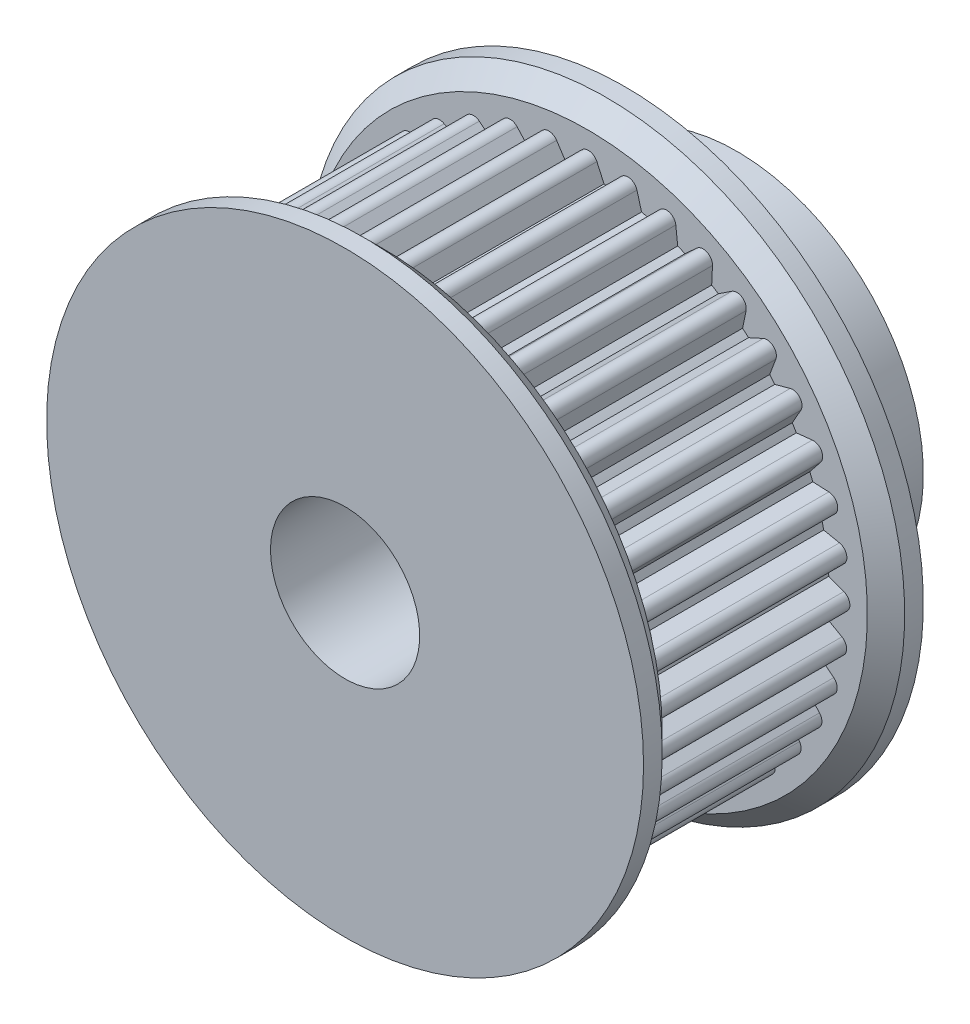
from build123d import *

# Parameters (mm, degrees)
EXTRUDE_3_DEPTH           = 11
FILLET_3_R                = 0.5
SKETCH_3_R                = 16
EXTRUDE_4_DEPTH           = 2
EXTRUDE_START             = 2
SKETCH_4_R                = 16
EXTRUDE_5_DEPTH           = 2
CHAMFER_1_SIZE            = 1
CHAMFER_2_SIZE            = 1
SKETCH_5_R                = 10
EXTRUDE_6_DEPTH           = 6
SKETCH_6_R                = 4
CUT_EXTRUDE_1_DEPTH       = 31.870698081
HOLE_WIZARD_5_44_1_REACH  = 37.428
HOLE_WIZARD_5_44_1_BORE_R = 1.3208
HOLE_WIZARD_5_44_2_D      = 2.6416
HOLE_WIZARD_5_44_2_DEPTH  = 10


with BuildPart() as part:
    # 草图1 → 凸台-拉伸3 (new body)
    with BuildSketch(Plane.XY):
        with BuildLine():
            Line((0.88236931, 12.919904195), (0, 14.865750082))
            Line((0, 14.865750082), (-0.728069899, 12.929517169))
            ThreePointArc((-0.728069899, 12.929517169), (-0.938966192, 12.915914311), (-1.149612422, 12.898871706))
            Line((-1.149612422, 12.898871706), (-2.325515662, 14.68272803))
            Line((-2.325515662, 14.68272803), (-2.741728252, 12.656438132))
            ThreePointArc((-2.741728252, 12.656438132), (-2.947900106, 12.610011299), (-3.15328688, 12.560226186))
            Line((-3.15328688, 12.560226186), (-4.59376941, 14.138168485))
            Line((-4.59376941, 14.138168485), (-4.687876156, 12.071715584))
            ThreePointArc((-4.687876156, 12.071715584), (-4.884246936, 11.993607959), (-5.07931695, 11.912306213))
            Line((-5.07931695, 11.912306213), (-6.748909309, 13.24548031))
            Line((-6.748909309, 13.24548031), (-6.518592991, 11.189747335))
            ThreePointArc((-6.518592991, 11.189747335), (-6.700327396, 11.081882186), (-6.88027738, 10.971065727))
            Line((-6.88027738, 10.971065727), (-8.737868663, 12.026644451))
            Line((-8.737868663, 12.026644451), (-8.188800432, 10.03225037))
            ThreePointArc((-8.188800432, 10.03225037), (-8.351423559, 9.897283695), (-8.511822546, 9.759681191))
            Line((-8.511822546, 9.759681191), (-10.511672691, 10.511672691))
            Line((-10.511672691, 10.511672691), (-9.65737243, 8.627726105))
            ThreePointArc((-9.65737243, 8.627726105), (-9.796879957, 8.468981233), (-9.933778392, 8.307980913))
            Line((-9.933778392, 8.307980913), (-12.026644451, 8.737868663))
            Line((-12.026644451, 8.737868663), (-10.888147868, 7.01075859))
            ThreePointArc((-10.888147868, 7.01075859), (-11.001104656, 6.832144345), (-11.111131646, 6.651710574))
            Line((-11.111131646, 6.651710574), (-13.24548031, 6.748909309))
            Line((-13.24548031, 6.748909309), (-11.850820969, 5.221162931))
            ThreePointArc((-11.850820969, 5.221162931), (-11.934445648, 5.027077389), (-12.014891962, 4.831653044))
            Line((-12.014891962, 4.831653044), (-14.138168485, 4.59376941))
            Line((-14.138168485, 4.59376941), (-12.521687528, 3.303004913))
            ThreePointArc((-12.521687528, 3.303004913), (-12.57392098, 3.098227104), (-12.622805764, 2.89262418))
            Line((-12.622805764, 2.89262418), (-14.68272803, 2.325515662))
            Line((-14.68272803, 2.325515662), (-12.884228582, 1.303515951))
            ThreePointArc((-12.884228582, 1.303515951), (-12.903784647, 1.093088185), (-12.919904195, 0.88236931))
            Line((-12.919904195, 0.88236931), (-14.865750082, 0))
            Line((-14.865750082, 0), (-12.929517169, -0.728069899))
            ThreePointArc((-12.929517169, -0.728069899), (-12.915914311, -0.938966192), (-12.898871706, -1.149612422))
            Line((-12.898871706, -1.149612422), (-14.68272803, -2.325515662))
            Line((-14.68272803, -2.325515662), (-12.656438132, -2.741728252))
            ThreePointArc((-12.656438132, -2.741728252), (-12.610011299, -2.947900106), (-12.560226186, -3.15328688))
            Line((-12.560226186, -3.15328688), (-14.138168485, -4.59376941))
            Line((-14.138168485, -4.59376941), (-12.071715584, -4.687876156))
            ThreePointArc((-12.071715584, -4.687876156), (-11.993607959, -4.884246936), (-11.912306213, -5.07931695))
            Line((-11.912306213, -5.07931695), (-13.24548031, -6.748909309))
            Line((-13.24548031, -6.748909309), (-11.189747335, -6.518592991))
            ThreePointArc((-11.189747335, -6.518592991), (-11.081882186, -6.700327396), (-10.971065727, -6.88027738))
            Line((-10.971065727, -6.88027738), (-12.026644451, -8.737868663))
            Line((-12.026644451, -8.737868663), (-10.03225037, -8.188800432))
            ThreePointArc((-10.03225037, -8.188800432), (-9.897283695, -8.351423559), (-9.759681191, -8.511822546))
            Line((-9.759681191, -8.511822546), (-10.511672691, -10.511672691))
            Line((-10.511672691, -10.511672691), (-8.627726105, -9.65737243))
            ThreePointArc((-8.627726105, -9.65737243), (-8.468981233, -9.796879957), (-8.307980913, -9.933778392))
            Line((-8.307980913, -9.933778392), (-8.737868663, -12.026644451))
            Line((-8.737868663, -12.026644451), (-7.01075859, -10.888147868))
            ThreePointArc((-7.01075859, -10.888147868), (-6.832144345, -11.001104656), (-6.651710574, -11.111131646))
            Line((-6.651710574, -11.111131646), (-6.748909309, -13.24548031))
            Line((-6.748909309, -13.24548031), (-5.221162931, -11.850820969))
            ThreePointArc((-5.221162931, -11.850820969), (-5.027077389, -11.934445648), (-4.831653044, -12.014891962))
            Line((-4.831653044, -12.014891962), (-4.59376941, -14.138168485))
            Line((-4.59376941, -14.138168485), (-3.303004913, -12.521687528))
            ThreePointArc((-3.303004913, -12.521687528), (-3.098227104, -12.57392098), (-2.89262418, -12.622805764))
            Line((-2.89262418, -12.622805764), (-2.325515662, -14.68272803))
            Line((-2.325515662, -14.68272803), (-1.303515951, -12.884228582))
            ThreePointArc((-1.303515951, -12.884228582), (-1.093088185, -12.903784647), (-0.88236931, -12.919904195))
            Line((-0.88236931, -12.919904195), (0, -14.865750082))
            Line((0, -14.865750082), (0.728069899, -12.929517169))
            ThreePointArc((0.728069899, -12.929517169), (0.938966192, -12.915914311), (1.149612422, -12.898871706))
            Line((1.149612422, -12.898871706), (2.325515662, -14.68272803))
            Line((2.325515662, -14.68272803), (2.741728252, -12.656438132))
            ThreePointArc((2.741728252, -12.656438132), (2.947900106, -12.610011299), (3.15328688, -12.560226186))
            Line((3.15328688, -12.560226186), (4.59376941, -14.138168485))
            Line((4.59376941, -14.138168485), (4.687876156, -12.071715584))
            ThreePointArc((4.687876156, -12.071715584), (4.884246936, -11.993607959), (5.07931695, -11.912306213))
            Line((5.07931695, -11.912306213), (6.748909309, -13.24548031))
            Line((6.748909309, -13.24548031), (6.518592991, -11.189747335))
            ThreePointArc((6.518592991, -11.189747335), (6.700327396, -11.081882186), (6.88027738, -10.971065727))
            Line((6.88027738, -10.971065727), (8.737868663, -12.026644451))
            Line((8.737868663, -12.026644451), (8.188800432, -10.03225037))
            ThreePointArc((8.188800432, -10.03225037), (8.351423559, -9.897283695), (8.511822546, -9.759681191))
            Line((8.511822546, -9.759681191), (10.511672691, -10.511672691))
            Line((10.511672691, -10.511672691), (9.65737243, -8.627726105))
            ThreePointArc((9.65737243, -8.627726105), (9.796879957, -8.468981233), (9.933778392, -8.307980913))
            Line((9.933778392, -8.307980913), (12.026644451, -8.737868663))
            Line((12.026644451, -8.737868663), (10.888147868, -7.01075859))
            ThreePointArc((10.888147868, -7.01075859), (11.001104656, -6.832144345), (11.111131646, -6.651710574))
            Line((11.111131646, -6.651710574), (13.24548031, -6.748909309))
            Line((13.24548031, -6.748909309), (11.850820969, -5.221162931))
            ThreePointArc((11.850820969, -5.221162931), (11.934445648, -5.027077389), (12.014891962, -4.831653044))
            Line((12.014891962, -4.831653044), (14.138168485, -4.59376941))
            Line((14.138168485, -4.59376941), (12.521687528, -3.303004913))
            ThreePointArc((12.521687528, -3.303004913), (12.57392098, -3.098227104), (12.622805764, -2.89262418))
            Line((12.622805764, -2.89262418), (14.68272803, -2.325515662))
            Line((14.68272803, -2.325515662), (12.884228582, -1.303515951))
            ThreePointArc((12.884228582, -1.303515951), (12.903784647, -1.093088185), (12.919904195, -0.88236931))
            Line((12.919904195, -0.88236931), (14.865750082, 0))
            Line((14.865750082, 0), (12.929517169, 0.728069899))
            ThreePointArc((12.929517169, 0.728069899), (12.915914311, 0.938966192), (12.898871706, 1.149612422))
            Line((12.898871706, 1.149612422), (14.68272803, 2.325515662))
            Line((14.68272803, 2.325515662), (12.656438132, 2.741728252))
            ThreePointArc((12.656438132, 2.741728252), (12.610011299, 2.947900106), (12.560226186, 3.15328688))
            Line((12.560226186, 3.15328688), (14.138168485, 4.59376941))
            Line((14.138168485, 4.59376941), (12.071715584, 4.687876156))
            ThreePointArc((12.071715584, 4.687876156), (11.993607959, 4.884246936), (11.912306213, 5.07931695))
            Line((11.912306213, 5.07931695), (13.24548031, 6.748909309))
            Line((13.24548031, 6.748909309), (11.189747335, 6.518592991))
            ThreePointArc((11.189747335, 6.518592991), (11.081882186, 6.700327396), (10.971065727, 6.88027738))
            Line((10.971065727, 6.88027738), (12.026644451, 8.737868663))
            Line((12.026644451, 8.737868663), (10.03225037, 8.188800432))
            ThreePointArc((10.03225037, 8.188800432), (9.897283695, 8.351423559), (9.759681191, 8.511822546))
            Line((9.759681191, 8.511822546), (10.511672691, 10.511672691))
            Line((10.511672691, 10.511672691), (8.627726105, 9.65737243))
            ThreePointArc((8.627726105, 9.65737243), (8.468981233, 9.796879957), (8.307980913, 9.933778392))
            Line((8.307980913, 9.933778392), (8.737868663, 12.026644451))
            Line((8.737868663, 12.026644451), (7.01075859, 10.888147868))
            ThreePointArc((7.01075859, 10.888147868), (6.832144345, 11.001104656), (6.651710574, 11.111131646))
            Line((6.651710574, 11.111131646), (6.748909309, 13.24548031))
            Line((6.748909309, 13.24548031), (5.221162931, 11.850820969))
            ThreePointArc((5.221162931, 11.850820969), (5.027077389, 11.934445648), (4.831653044, 12.014891962))
            Line((4.831653044, 12.014891962), (4.59376941, 14.138168485))
            Line((4.59376941, 14.138168485), (3.303004913, 12.521687528))
            ThreePointArc((3.303004913, 12.521687528), (3.098227104, 12.57392098), (2.89262418, 12.622805764))
            Line((2.89262418, 12.622805764), (2.325515662, 14.68272803))
            Line((2.325515662, 14.68272803), (1.303515951, 12.884228582))
            ThreePointArc((1.303515951, 12.884228582), (1.093088185, 12.903784647), (0.88236931, 12.919904195))
        make_face()
    extrude(amount=EXTRUDE_3_DEPTH)

    # 圆角3
    fillet_3_edges = [part.edges().sort_by_distance(p)[0] for p in [
        (-12.026644451, 8.737868663, 5.5),
        (-13.24548031, 6.748909309, 5.5),
        (-14.138168485, 4.59376941, 5.5),
        (-14.68272803, 2.325515662, 5.5),
        (-14.865750082, 0, 5.5),
        (-14.68272803, -2.325515662, 5.5),
        (-14.138168485, -4.59376941, 5.5),
        (-13.24548031, -6.748909309, 5.5),
        (-10.511672691, -10.511672691, 5.5),
        (-12.026644451, -8.737868663, 5.5),
        (-8.737868663, -12.026644451, 5.5),
        (-6.748909309, -13.24548031, 5.5),
        (-4.59376941, -14.138168485, 5.5),
        (-2.325515662, -14.68272803, 5.5),
        (0, -14.865750082, 5.5),
        (2.325515662, -14.68272803, 5.5),
        (4.59376941, -14.138168485, 5.5),
        (8.737868663, -12.026644451, 5.5),
        (6.748909309, -13.24548031, 5.5),
        (10.511672691, -10.511672691, 5.5),
        (12.026644451, -8.737868663, 5.5),
        (13.24548031, -6.748909309, 5.5),
        (14.138168485, -4.59376941, 5.5),
        (14.68272803, -2.325515662, 5.5),
        (14.865750082, 0, 5.5),
        (14.68272803, 2.325515662, 5.5),
        (14.138168485, 4.59376941, 5.5),
        (13.24548031, 6.748909309, 5.5),
        (12.026644451, 8.737868663, 5.5),
        (10.511672691, 10.511672691, 5.5),
        (8.737868663, 12.026644451, 5.5),
        (6.748909309, 13.24548031, 5.5),
        (4.59376941, 14.138168485, 5.5),
        (2.325515662, 14.68272803, 5.5),
        (0, 14.865750082, 5.5),
        (-2.325515662, 14.68272803, 5.5),
        (-4.59376941, 14.138168485, 5.5),
        (-6.748909309, 13.24548031, 5.5),
        (-8.737868663, 12.026644451, 5.5),
        (-10.511672691, 10.511672691, 5.5),
    ]]
    fillet(fillet_3_edges, radius=FILLET_3_R)

    # 草图3 → 凸台-拉伸4 (add)
    with BuildSketch(Plane.XY.offset(11)):
        Circle(SKETCH_3_R)
    extrude(amount=EXTRUDE_4_DEPTH)

    # 草图4 → 凸台-拉伸5 (add)
    with BuildSketch(Plane(origin=(0, 0, 0), x_dir=(-1, 0, 0), z_dir=(0, 0, -1)).offset(EXTRUDE_START)):
        with Locations(Location((0, 0, 0), (0, 0, 180))):
            Circle(SKETCH_4_R)
    extrude(amount=-EXTRUDE_5_DEPTH)

    # 倒角1
    chamfer_1_edges = [part.edges().sort_by_distance(p)[0] for p in [
        (-16, 0, 11),
    ]]
    chamfer(chamfer_1_edges, length=CHAMFER_1_SIZE)

    # 倒角2
    chamfer_2_edges = [part.edges().sort_by_distance(p)[0] for p in [
        (-16, 0, 0),
    ]]
    chamfer(chamfer_2_edges, length=CHAMFER_2_SIZE)

    # 草图5 → 凸台-拉伸6 (add)
    with BuildSketch(Plane(origin=(0, 0, -2), x_dir=(-1, 0, 0), z_dir=(0, 0, -1))):
        Circle(SKETCH_5_R)
    extrude(amount=EXTRUDE_6_DEPTH)

    # 草图6 → 切除-拉伸1 (cut, through all)
    with BuildSketch(Plane(origin=(0, 0, -8), x_dir=(-1, 0, 0), z_dir=(0, 0, -1))):
        Circle(SKETCH_6_R)
    extrude(amount=-CUT_EXTRUDE_1_DEPTH, mode=Mode.SUBTRACT)

    # #5-44 螺纹孔1 bore (on position points) → #5-44 螺纹孔1 (cut, up to next)
    with BuildSketch(Plane(origin=(0.017039923, 9.999985482, -4.96012697), x_dir=(0.999998548204, -0.001703992301, 0), z_dir=(0.001703992301, 0.999998548204, 0)), mode=Mode.PRIVATE) as hole_wizard_5_44_1_sk1:
        Circle(HOLE_WIZARD_5_44_1_BORE_R)
    hole_wizard_5_44_1_tool1 = extrude(hole_wizard_5_44_1_sk1.sketch, amount=-HOLE_WIZARD_5_44_1_REACH, mode=Mode.PRIVATE) & part.part
    add(hole_wizard_5_44_1_tool1.solids().sort_by_distance((0.01704, 9.999985, -4.960127))[0], mode=Mode.SUBTRACT)

    # #5-44 螺纹孔2
    with Locations(Plane(origin=(8.381891781, -5.453795942, -5.114894865), x_dir=(0.545379594159, 0.838189178094, 0), z_dir=(0.838189178094, -0.545379594159, 0))):
        with Locations((0, 0)):
            Hole(HOLE_WIZARD_5_44_2_D / 2, depth=HOLE_WIZARD_5_44_2_DEPTH)


solid = part.part
